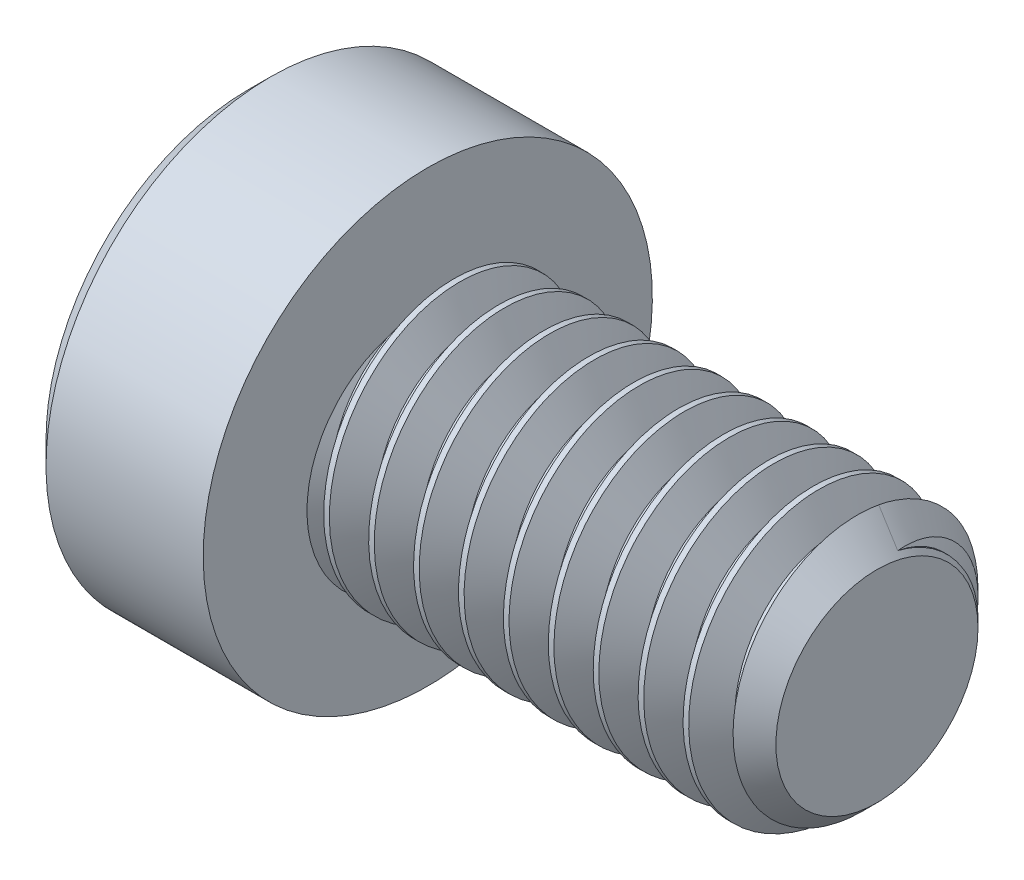
from build123d import *

# Parameters (mm, degrees)
SKETCH2_R           = 3
BOSS_EXTRUDE1_DEPTH = 10
CHAMFER1_SIZE       = 0.75
CUT_SWEEP1_PITCH    = 1
CUT_EXTRUDE1_DEPTH  = 3.12


with BuildPart() as part:
    # Sketch2 → Boss-Extrude1 (new body)
    with BuildSketch(Plane(origin=(5, 0, 0), x_dir=(0, 0, -1), z_dir=(1, 0, 0))):
        Circle(SKETCH2_R)
    extrude(amount=-BOSS_EXTRUDE1_DEPTH)

    # Chamfer1
    chamfer1_edges = [part.edges().sort_by_distance(p)[0] for p in [
        (5, 0, 3),
    ]]
    chamfer(chamfer1_edges, length=CHAMFER1_SIZE)

    # Cut-Sweep1: the profile of Sketch5 profile screwed along a right-hand helix of 11 turns, 8 arcs to a turn; built about Z, then put on its axis
    cut_sweep1_z = Axis((0, 0, 0), (0, 0, 1))
    cut_sweep1_corners = [(3.0003, 0, 0.437673205), (3.0003, 0, -0.437673205), (2.350480947, 0, -0.0625), (2.350480947, 0, 0.0625)]
    with BuildLine(mode=Mode.PRIVATE) as cut_sweep1_profile:
        Line(cut_sweep1_corners[0], cut_sweep1_corners[1])
        Line(cut_sweep1_corners[1], cut_sweep1_corners[2])
        Line(cut_sweep1_corners[2], cut_sweep1_corners[3])
        Line(cut_sweep1_corners[3], cut_sweep1_corners[0])
    cut_sweep1_cap = Face(cut_sweep1_profile.wire())
    cut_sweep1_turn_angles = [0, 22.5, 45, 67.5, 90, 112.5, 135, 157.5, 180, 202.5, 225, 247.5, 270, 292.5, 315, 337.5, 360]
    cut_sweep1_turn_weights = [1, 0.9238795325112867, 1, 0.9238795325112867, 1, 0.9238795325112867, 1, 0.9238795325112867, 1, 0.9238795325112867, 1, 0.9238795325112867, 1, 0.9238795325112867, 1, 0.9238795325112867, 1]
    cut_sweep1_turn_rails = [Edge.make_bspline([Vector(p[0], p[1], 0).rotate(cut_sweep1_z, cut_sweep1_turn_angles[k]) / cut_sweep1_turn_weights[k] + Vector(0, 0, p[2] + CUT_SWEEP1_PITCH * cut_sweep1_turn_angles[k] / 360) for k in range(17)], [0, 0, 0, 1, 1, 2, 2, 3, 3, 4, 4, 5, 5, 6, 6, 7, 7, 8, 8, 8], 2, cut_sweep1_turn_weights) for p in cut_sweep1_corners]
    cut_sweep1_turn_sides = [Face.make_surface_from_curves(cut_sweep1_turn_rails[p[0]], cut_sweep1_turn_rails[p[1]]) for p in [(0, 1), (1, 2), (2, 3), (3, 0)]]
    cut_sweep1 = Plane(origin=(5, 0, 0), x_dir=(0, 1, 0), z_dir=(-1, 0, 0)) * Solid(Shell([*[p.moved(Location((0, 0, CUT_SWEEP1_PITCH * i))) for i in range(11) for p in cut_sweep1_turn_sides], cut_sweep1_cap, cut_sweep1_cap.rotate(cut_sweep1_z, 3960).moved(Location((0, 0, CUT_SWEEP1_PITCH * 3960 / 360)))]))
    add(cut_sweep1, mode=Mode.SUBTRACT)

    # Sketch6 → Revolve1 (revolve)
    with BuildSketch(Plane.XY, mode=Mode.PRIVATE) as revolve1_sk:
        Polygon((-8.5, 5), (-9, 4.5), (-9, 0), (-5, 0), (-5, 5), align=None)
    revolve(revolve1_sk.sketch.rotate(Axis((-5, 0, 0), (-1, 0, 0)), 13.865622854), axis=Axis((-5, 0, 0), (-1, 0, 0)))

    # Sketch4 → Cut-Extrude1 (cut)
    with BuildSketch(Plane(origin=(-9, 0, 0), x_dir=(0, 0, -1), z_dir=(1, 0, 0))):
        Polygon((0, 2.309401077), (-2, 1.154700538), (-2, -1.154700538), (0, -2.309401077), (2, -1.154700538), (2, 1.154700538), align=None)
    extrude(amount=CUT_EXTRUDE1_DEPTH, mode=Mode.SUBTRACT)

    # Cut-Extrude2 cone 1 section (through the dimple's axis) → Cut-Extrude2 (revolve, cut)
    with BuildSketch(Plane(origin=(-9, 0, 0), x_dir=(0, 0, 1), z_dir=(0, 1, 0))):
        Polygon((0, 0), (2.309401077, 0), (0, 2.309401077), align=None)
    revolve(axis=Axis((-9, 0, 0), (1, 0, 0)), mode=Mode.SUBTRACT)


solid = part.part
